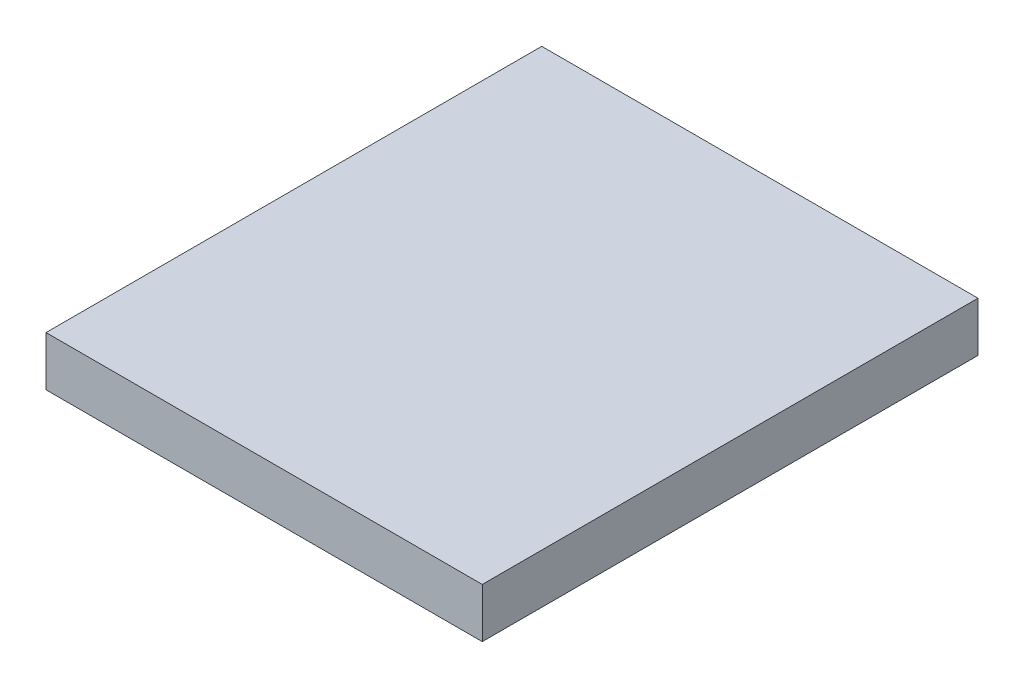
from build123d import *

# Parameters (mm, degrees)
SKETCH1_W           = 440
SKETCH1_H           = 500
BOSS_EXTRUDE1_DEPTH = 50


with BuildPart() as part:
    # Sketch1 → Boss-Extrude1 (new body)
    with BuildSketch(Plane(origin=(0, 0, 0), x_dir=(1, 0, 0), z_dir=(0, 1, 0))):
        Rectangle(SKETCH1_W, SKETCH1_H)
    extrude(amount=BOSS_EXTRUDE1_DEPTH)


solid = part.part
